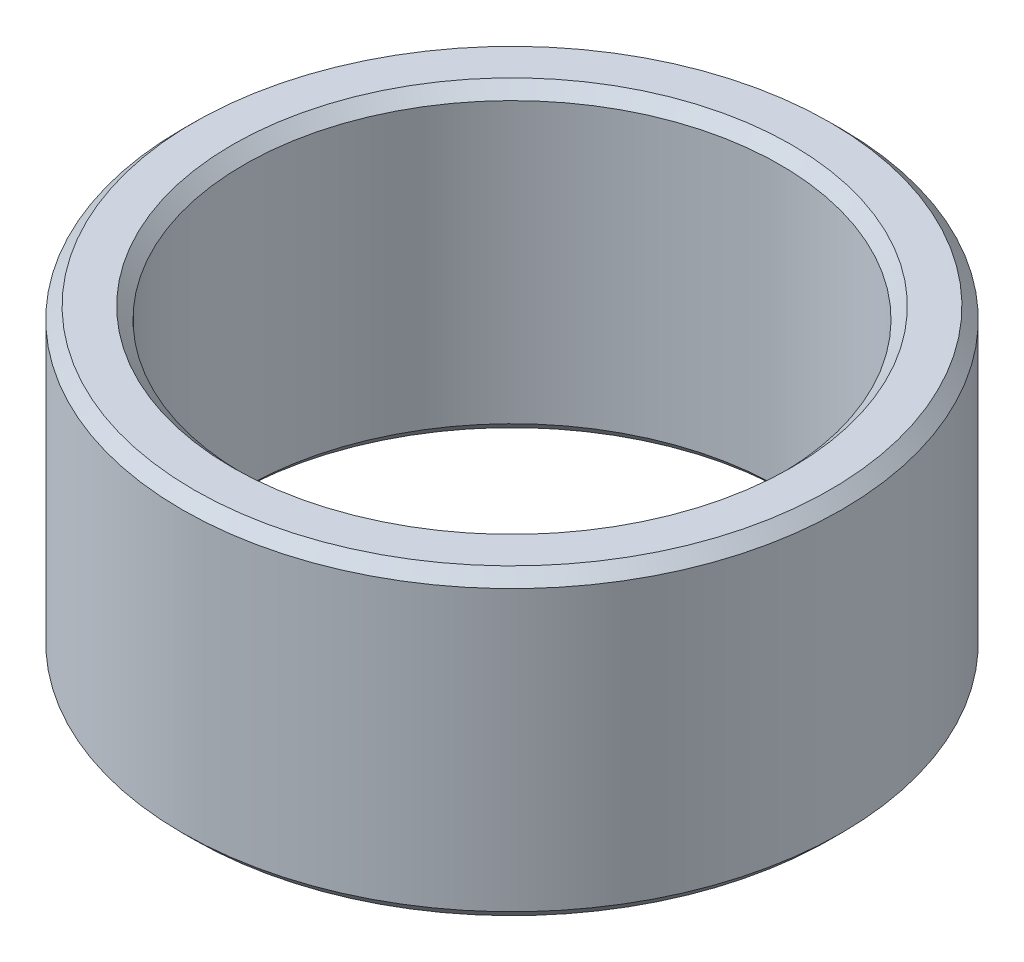
from build123d import *

# Parameters (mm, degrees)
SKETCH1_R           = 32.5
BOSS_EXTRUDE1_DEPTH = 29.858229892
SKETCH2_R           = 26.421388433
CUT_EXTRUDE1_DEPTH  = 55.808885158
CHAMFER1_SIZE       = 1.137025343


with BuildPart() as part:
    # Sketch1 → Boss-Extrude1 (new body)
    with BuildSketch(Plane(origin=(0, 0, 0), x_dir=(1, 0, 0), z_dir=(0, 1, 0))):
        Circle(SKETCH1_R)
    extrude(amount=BOSS_EXTRUDE1_DEPTH)

    # Sketch2 → Cut-Extrude1 (cut, through all)
    with BuildSketch(Plane(origin=(0, 0, 0), x_dir=(1, 0, 0), z_dir=(0, 1, 0))):
        Circle(SKETCH2_R)
    extrude(amount=CUT_EXTRUDE1_DEPTH, mode=Mode.SUBTRACT)

    # Chamfer1
    chamfer1_edges = [part.edges().sort_by_distance(p)[0] for p in [
        (-26.421388433, 29.858229892, 0),
        (-26.421388433, 0, 0),
        (-32.5, 0, 0),
        (-32.5, 29.858229892, 0),
    ]]
    chamfer(chamfer1_edges, length=CHAMFER1_SIZE)


solid = part.part
